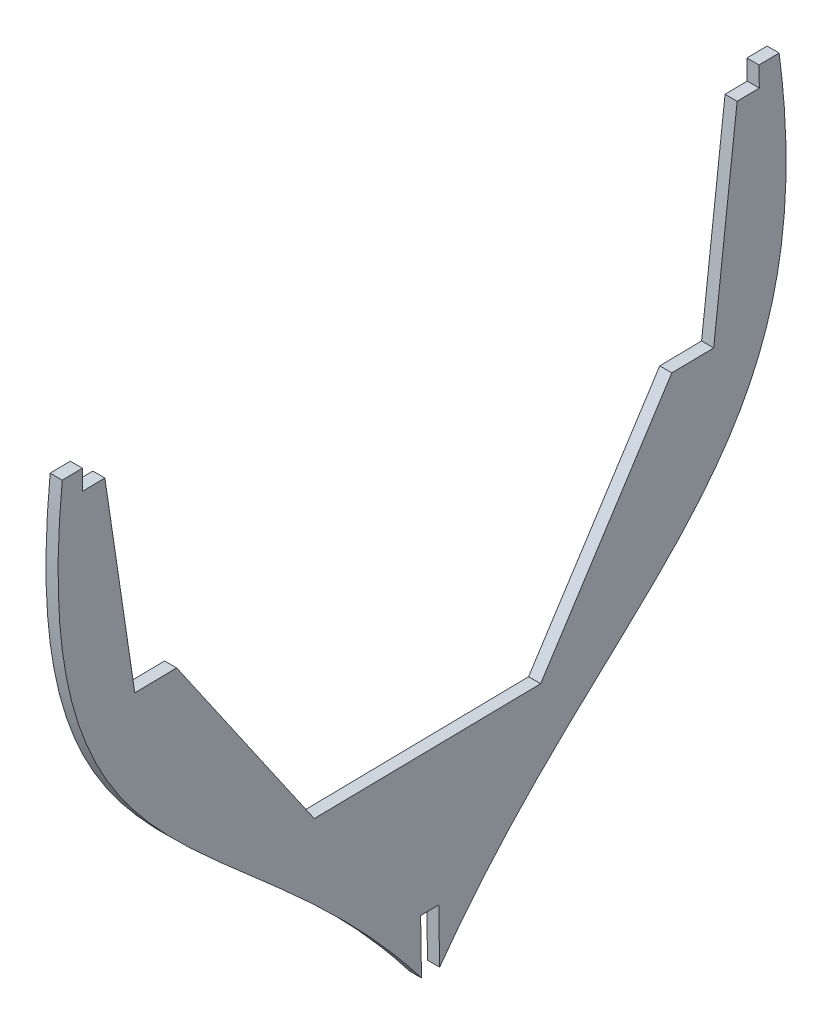
from build123d import *

# Parameters (mm, degrees)
BOSS_EXTRU_3_DEPTH      = 6
ENL_V_MAT_EXTRU_1_DEPTH = 6


with BuildPart() as part:
    # Esquisse2 → Boss.-Extru.3 (new body)
    with BuildSketch(Plane(origin=(0, 0, 0), x_dir=(0, 0, -1), z_dir=(1, 0, 0))):
        with BuildLine():
            Line((-183.471068397, 344.531708839), (-173.472348378, 344.691702585))
            Line((-173.472348378, 344.691702585), (-173.312354632, 334.692982567))
            Line((-173.312354632, 334.692982567), (-162.306171855, 334.869097151))
            Line((-162.306171855, 334.869097151), (-147.456450827, 235.093912358))
            Line((-147.456450827, 235.093912358), (-126.680308332, 235.426360197))
            Line((-126.680308332, 235.426360197), (-58.381147479, 136.506442486))
            Line((-58.381147479, 136.506442486), (53.983782352, 138.304441231))
            Line((53.983782352, 138.304441231), (119.083068285, 239.358923883))
            Line((119.083068285, 239.358923883), (139.85921078, 239.691371722))
            Line((139.85921078, 239.691371722), (151.509056888, 339.890587292))
            Line((151.509056888, 339.890587292), (162.515239665, 340.066701876))
            Line((162.515239665, 340.066701876), (162.355245919, 350.065421894))
            Line((162.355245919, 350.065421894), (172.353965937, 350.22541564))
            add(Edge.make_bspline(
                [(172.353965937, 350.22541564), (196.585514965, 167.485312311), (88.821085036, 164.888621095), (-0.564184596, 35.258402004)],
                knots=[0, 0, 0, 0, 1, 1, 1, 1], degree=3))
            add(Edge.make_bspline(
                [(-183.471068397, 344.531708839), (-201.843505569, 161.109881117), (-94.051166479, 161.962404888), (-0.564184596, 35.258402004)],
                knots=[0, 0, 0, 0, 1, 1, 1, 1], degree=3))
        make_face()
    extrude(amount=BOSS_EXTRU_3_DEPTH)

    # Esquisse3 → Enlèv. mat.-Extru.1 (cut)
    with BuildSketch(Plane(origin=(6, 0, 0), x_dir=(0, 0, -1), z_dir=(1, 0, 0))):
        Polygon((-5.163223095, 41.375751423), (-5.595261509, 68.375751423), (3.404738491, 68.519764228), (3.836776905, 41.519764228), (15.859167, 26.122565609), (-12.729113987, 26.122565609), align=None)
    extrude(amount=-ENL_V_MAT_EXTRU_1_DEPTH, mode=Mode.SUBTRACT)


solid = part.part
